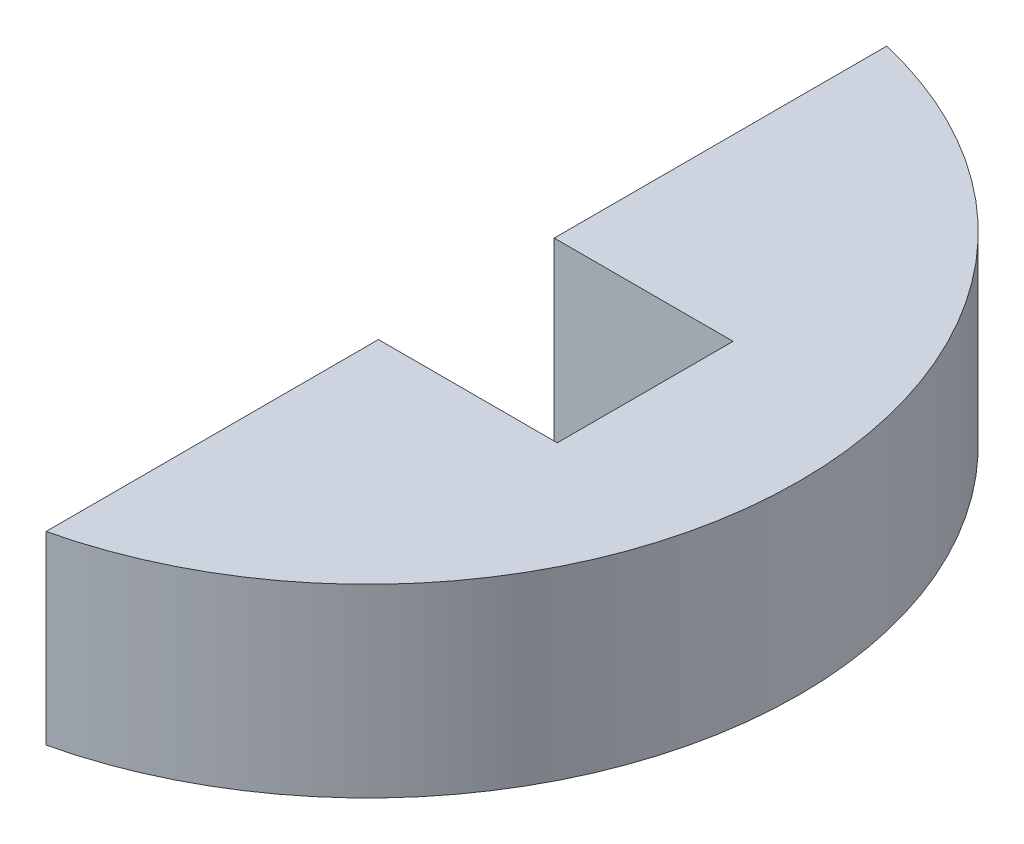
from build123d import *

# Parameters (mm, degrees)
BOSS_EXTRUDE1_DEPTH      = 1.5
BOSS_EXTRUDE1_DEPTH_BACK = 1.5


with BuildPart() as part:
    # Sketch1 → Boss-Extrude1 (new, two sides: drawn at the far end of the back side and taken through both)
    with BuildSketch(Plane(origin=(0, 0, 0), x_dir=(1, 0, 0), z_dir=(0, 1, 0)).offset(-BOSS_EXTRUDE1_DEPTH_BACK)):
        with BuildLine():
            Line((1.6, -6.814690015), (1.6, -1.425))
            Line((1.6, -1.425), (4.5, -1.425))
            Line((4.5, -1.425), (4.5, 1.425))
            Line((4.5, 1.425), (1.6, 1.425))
            Line((1.6, 1.425), (1.6, 6.814690015))
            ThreePointArc((1.6, 6.814690015), (7, 0), (1.6, -6.814690015))
        make_face()
    extrude(amount=BOSS_EXTRUDE1_DEPTH + BOSS_EXTRUDE1_DEPTH_BACK)


solid = part.part
